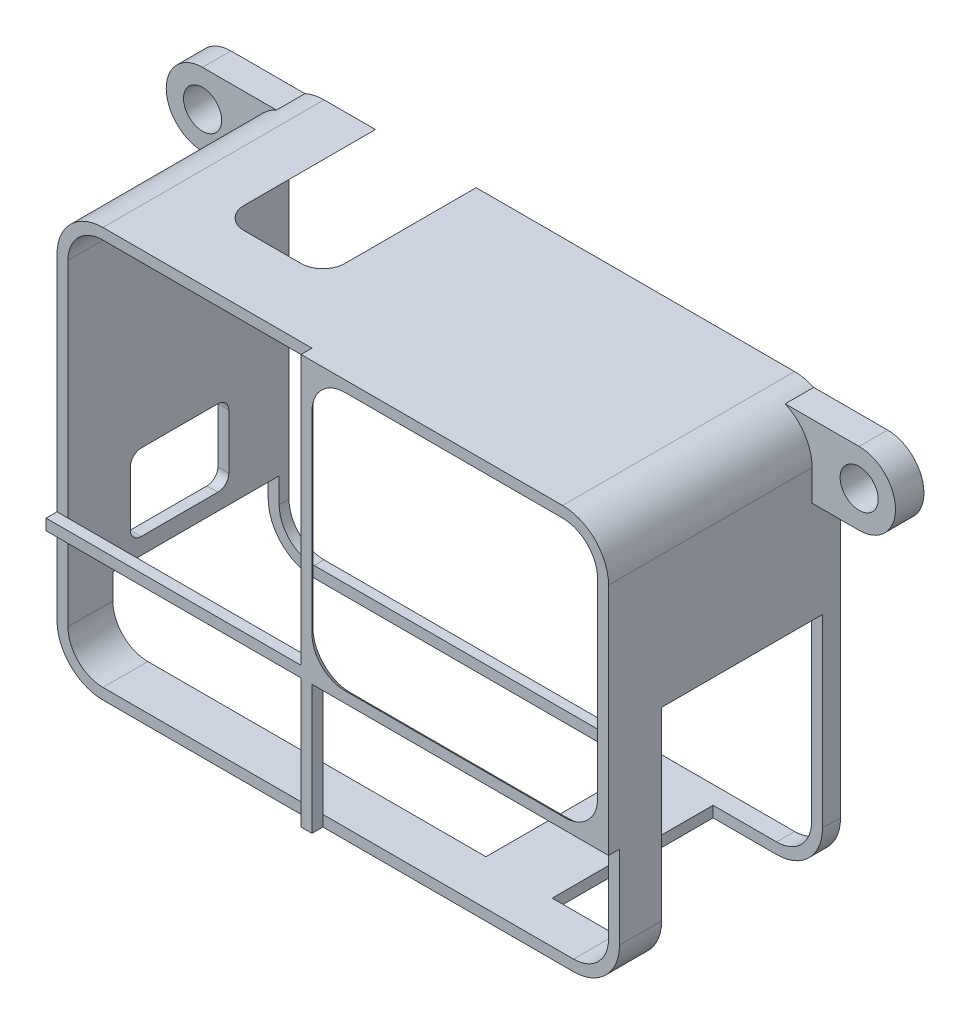
from build123d import *

# Parameters (mm, degrees)
BOSS_EXTRUDE1_DEPTH = 25.654
BOSS_EXTRUDE2_DEPTH = 1.27
CUT_EXTRUDE1_REACH  = 65.61
CUT_EXTRUDE2_REACH  = 76.499
SKETCH7_W           = 44.577
SKETCH7_H           = 19.304
CUT_EXTRUDE3_DEPTH  = 8.255
SKETCH8_W           = 18.669
SKETCH8_H           = 26.797
CUT_EXTRUDE4_DEPTH  = 12.7
FILLET2_R           = 2.54
SKETCH9_R           = 2.2098
BOSS_EXTRUDE3_DEPTH = 3.302
CHAMFER1_SIZE       = 1.27


# Some blends are built 0.0001 mm under size
with BuildPart() as part:
    # Sketch2 → Boss-Extrude1 (new body)
    with BuildSketch(Plane.XY):
        with BuildLine():
            Line((-27.305, -23.749), (27.305, -23.749))
            ThreePointArc((27.305, -23.749), (31.076707571, -22.186707571), (32.639, -18.415))
            Line((32.639, -18.415), (32.639, 18.415))
            ThreePointArc((32.639, 18.415), (31.076707571, 22.186707571), (27.305, 23.749))
            Line((27.305, 23.749), (-27.305, 23.749))
            ThreePointArc((-27.305, 23.749), (-31.076707571, 22.186707571), (-32.639, 18.415))
            Line((-32.639, 18.415), (-32.639, -18.415))
            ThreePointArc((-32.639, -18.415), (-31.076707571, -22.186707571), (-27.305, -23.749))
        make_face()
        with BuildLine():
            Line((-27.305, -22.479), (27.305, -22.479))
            ThreePointArc((27.305, -22.479), (30.178681959, -21.288681959), (31.369, -18.415))
            Line((31.369, -18.415), (31.369, 18.415))
            ThreePointArc((31.369, 18.415), (30.178681959, 21.288681959), (27.305, 22.479))
            Line((27.305, 22.479), (-27.305, 22.479))
            ThreePointArc((-27.305, 22.479), (-30.178681959, 21.288681959), (-31.369, 18.415))
            Line((-31.369, 18.415), (-31.369, -18.415))
            ThreePointArc((-31.369, -18.415), (-30.178681959, -21.288681959), (-27.305, -22.479))
        make_face(mode=Mode.SUBTRACT)
    extrude(amount=BOSS_EXTRUDE1_DEPTH)

    # Sketch3 → Boss-Extrude2 (add)
    with BuildSketch(Plane.XY.offset(25.654)):
        with BuildLine():
            Line((-1.778, 23.749), (27.305, 23.749))
            ThreePointArc((27.305, 23.749), (31.076707571, 22.186707571), (32.639, 18.415))
            Line((32.639, 18.415), (32.639, -7.493))
            Line((32.639, -7.493), (32.639, -8.763))
            Line((32.639, -8.763), (-1.778, -8.763))
            Line((-1.778, -8.763), (-1.778, -23.749))
            Line((-1.778, -23.749), (-3.048, -23.749))
            Line((-3.048, -23.749), (-3.048, -8.763))
            Line((-3.048, -8.763), (-32.639, -8.763))
            Line((-32.639, -8.763), (-32.639, -7.493))
            Line((-32.639, -7.493), (-3.048, -7.493))
            Line((-3.048, -7.493), (-3.048, 23.749))
            Line((-3.048, 23.749), (-1.778, 23.749))
        make_face()
        with BuildLine():
            Line((27.559, -7.493), (2.032, -7.493))
            ThreePointArc((2.032, -7.493), (-0.662076836, -6.377076836), (-1.778, -3.683))
            Line((-1.778, -3.683), (-1.778, 18.669))
            ThreePointArc((-1.778, 18.669), (-0.662076836, 21.363076836), (2.032, 22.479))
            Line((2.032, 22.479), (27.305, 22.479))
            ThreePointArc((27.305, 22.479), (30.178681959, 21.288681959), (31.369, 18.415))
            Line((31.369, 18.415), (31.369, -3.683))
            ThreePointArc((31.369, -3.683), (30.253076836, -6.377076836), (27.559, -7.493))
        make_face(mode=Mode.SUBTRACT)
    extrude(amount=BOSS_EXTRUDE2_DEPTH)

    # Sketch5 → Cut-Extrude1 (cut, up to next)
    with BuildSketch(Plane(origin=(0, 23.749, 0), x_dir=(1, 0, 0), z_dir=(0, 1, 0)), mode=Mode.PRIVATE) as cut_extrude1_sk1:
        with BuildLine():
            Line((-21.336, 0), (-21.336, -15.24))
            ThreePointArc((-21.336, -15.24), (-20.592051224, -17.036051224), (-18.796, -17.78))
            Line((-18.796, -17.78), (-12.192, -17.78))
            ThreePointArc((-12.192, -17.78), (-10.395948776, -17.036051224), (-9.652, -15.24))
            Line((-9.652, -15.24), (-9.652, 0))
            Line((-9.652, 0), (-21.336, 0))
        make_face()
    cut_extrude1_tool1 = extrude(cut_extrude1_sk1.sketch, amount=-CUT_EXTRUDE1_REACH, mode=Mode.PRIVATE) & part.part
    add(cut_extrude1_tool1.solids().sort_by_distance((-15.494, 23.749, 8.777566))[0], mode=Mode.SUBTRACT)

    # Sketch6 → Cut-Extrude2 (cut, up to next)
    with BuildSketch(Plane.ZY.offset(32.639), mode=Mode.PRIVATE) as cut_extrude2_sk1:
        with BuildLine():
            Line((8.255, -4.699), (17.145, -4.699))
            ThreePointArc((17.145, -4.699), (18.043025612, -5.070974388), (18.415, -5.969))
            Line((18.415, -5.969), (18.415, -12.319))
            ThreePointArc((18.415, -12.319), (18.043025612, -13.217025612), (17.145, -13.589))
            Line((17.145, -13.589), (8.255, -13.589))
            ThreePointArc((8.255, -13.589), (7.356974388, -13.217025612), (6.985, -12.319))
            Line((6.985, -12.319), (6.985, -5.969))
            ThreePointArc((6.985, -5.969), (7.356974388, -5.070974388), (8.255, -4.699))
        make_face()
    cut_extrude2_tool1 = extrude(cut_extrude2_sk1.sketch, amount=-CUT_EXTRUDE2_REACH, mode=Mode.PRIVATE) & part.part
    add(cut_extrude2_tool1.solids().sort_by_distance((-32.639, -9.144, 12.7))[0], mode=Mode.SUBTRACT)

    # Sketch7 → Cut-Extrude3 (cut)
    with BuildSketch(Plane.XZ.offset(23.749)):
        with Locations((-10.3505, 10.795)):
            Rectangle(SKETCH7_W, SKETCH7_H)
    extrude(amount=-CUT_EXTRUDE3_DEPTH, mode=Mode.SUBTRACT)

    # Sketch8 → Cut-Extrude4 (cut)
    with BuildSketch(Plane(origin=(32.639, 0, 0), x_dir=(0, 0, -1), z_dir=(1, 0, 0))):
        with Locations((-11.43, -10.3505)):
            Rectangle(SKETCH8_W, SKETCH8_H)
    extrude(amount=-CUT_EXTRUDE4_DEPTH, mode=Mode.SUBTRACT)

    # Fillet2
    # the kernel refuses this fillet: 2.54 mm, written as the material it takes off along each edge
    with BuildSketch(Plane(origin=(2.032, 18.669, 25.654), x_dir=(-1, 0, 0), z_dir=(0, -1, 0))) as fillet2_piece_1_section:
        with BuildLine():
            CenterArc((6.009704526, -2.54), FILLET2_R, 90, 60)
            Line((3.81, -1.27), (3.81, 0))
            Line((3.81, 0), (6.009704526, 0))
        make_face()
    fillet2_piece_1 = revolve(axis=Axis((2.032, 18.669, 25.654), (0, 0, -1)), revolution_arc=172.73255531, mode=Mode.PRIVATE)
    fillet2_piece_1 = split(fillet2_piece_1, bisect_by=Plane(origin=(2.032, 22.479, 25.654), z_dir=(0, -1, 0)), keep=Keep.TOP, mode=Mode.PRIVATE)
    add(fillet2_piece_1, mode=Mode.SUBTRACT)
    with BuildSketch(Plane(origin=(2.032, -3.683, 25.654), x_dir=(0, -1, 0), z_dir=(1, 0, 0))) as fillet2_piece_2:
        with BuildLine():
            CenterArc((6.009704526, -2.54), FILLET2_R, 90, 60)
            Line((3.81, -1.27), (3.81, 0))
            Line((3.81, 0), (6.009704526, 0))
        make_face()
    revolve(axis=Axis((2.032, -3.683, 25.654), (0, 0, -1)), revolution_arc=90, mode=Mode.SUBTRACT)
    with BuildSketch(Plane(origin=(27.559, -3.683, 25.654), x_dir=(0.1265009963233053, 0.9919664802447767, 0), z_dir=(-0.9919664802447767, 0.1265009963233053, 0))) as fillet2_piece_3_section:
        with BuildLine():
            CenterArc((6.009704526, -2.54), FILLET2_R, 90, 60)
            Line((3.81, -1.27), (3.81, 0))
            Line((3.81, 0), (6.009704526, 0))
        make_face()
    fillet2_piece_3 = revolve(axis=Axis((27.559, -3.683, 25.654), (0, 0, -1)), revolution_arc=172.73255531, mode=Mode.PRIVATE)
    fillet2_piece_3 = split(fillet2_piece_3, bisect_by=Plane(origin=(31.369, -3.683, 25.654), z_dir=(-1, 0, 0)), keep=Keep.TOP, mode=Mode.PRIVATE)
    add(fillet2_piece_3, mode=Mode.SUBTRACT)
    with BuildSketch(Plane(origin=(27.559, -7.493, 25.654), x_dir=(0, -1, 0), z_dir=(-1, 0, 0))) as fillet2_piece_4:
        with BuildLine():
            CenterArc((2.199704526, 2.54), FILLET2_R, 210, 60)
            Line((0, 1.27), (0, 0))
            Line((0, 0), (2.199704526, 0))
        make_face()
    extrude(amount=25.527, mode=Mode.SUBTRACT)
    with BuildSketch(Plane(origin=(-1.778, -3.683, 25.654), x_dir=(-1, 0, 0), z_dir=(0, 1, 0))) as fillet2_piece_5:
        with BuildLine():
            CenterArc((2.199704526, 2.54), FILLET2_R, 210, 60)
            Line((0, 1.27), (0, 0))
            Line((0, 0), (2.199704526, 0))
        make_face()
    extrude(amount=22.352, mode=Mode.SUBTRACT)

    # Sketch9 → Boss-Extrude3 (add)
    # profile 1 of 2: a face of its own
    with BuildSketch(Plane.XY):
        with BuildLine():
            Line((-29.522086836, 23.2664), (-38.1, 23.2664))
            ThreePointArc((-38.1, 23.2664), (-42.3164, 19.05), (-38.1, 14.8336))
            Line((-38.1, 14.8336), (-32.639, 14.8336))
            Line((-32.639, 14.8336), (-32.639, 18.415))
            ThreePointArc((-32.639, 18.415), (-31.792621708, 21.298193959), (-29.522086836, 23.2664))
        make_face()
        with Locations(Location((-38.1, 19.05, 0), (0, 0, 180))):
            Circle(SKETCH9_R, mode=Mode.SUBTRACT)
    # profile 2 of 2: a face of its own
    with BuildSketch(Plane.XY):
        with BuildLine():
            Line((29.522086836, 23.2664), (38.1, 23.2664))
            ThreePointArc((38.1, 23.2664), (42.3164, 19.05), (38.1, 14.8336))
            Line((38.1, 14.8336), (32.639, 14.8336))
            Line((32.639, 14.8336), (32.639, 18.415))
            ThreePointArc((32.639, 18.415), (31.792621708, 21.298193959), (29.522086836, 23.2664))
        make_face()
        with Locations(Location((38.1, 19.05, 0), (0, 0, 180))):
            Circle(SKETCH9_R, mode=Mode.SUBTRACT)
    extrude(amount=BOSS_EXTRUDE3_DEPTH)

    # Chamfer1
    chamfer1_edges = [part.edges().sort_by_distance(p)[0] for p in [
        (-21.336, 22.479, 7.62),
        (-20.592051224, 22.479, 17.036051224),
        (-15.494, 22.479, 17.78),
        (-10.395948776, 22.479, 17.036051224),
        (-9.652, 22.479, 7.62),
    ]]
    chamfer(chamfer1_edges, length=CHAMFER1_SIZE - 0.0001)  # a hair under: the kernel refuses the full size


solid = part.part
